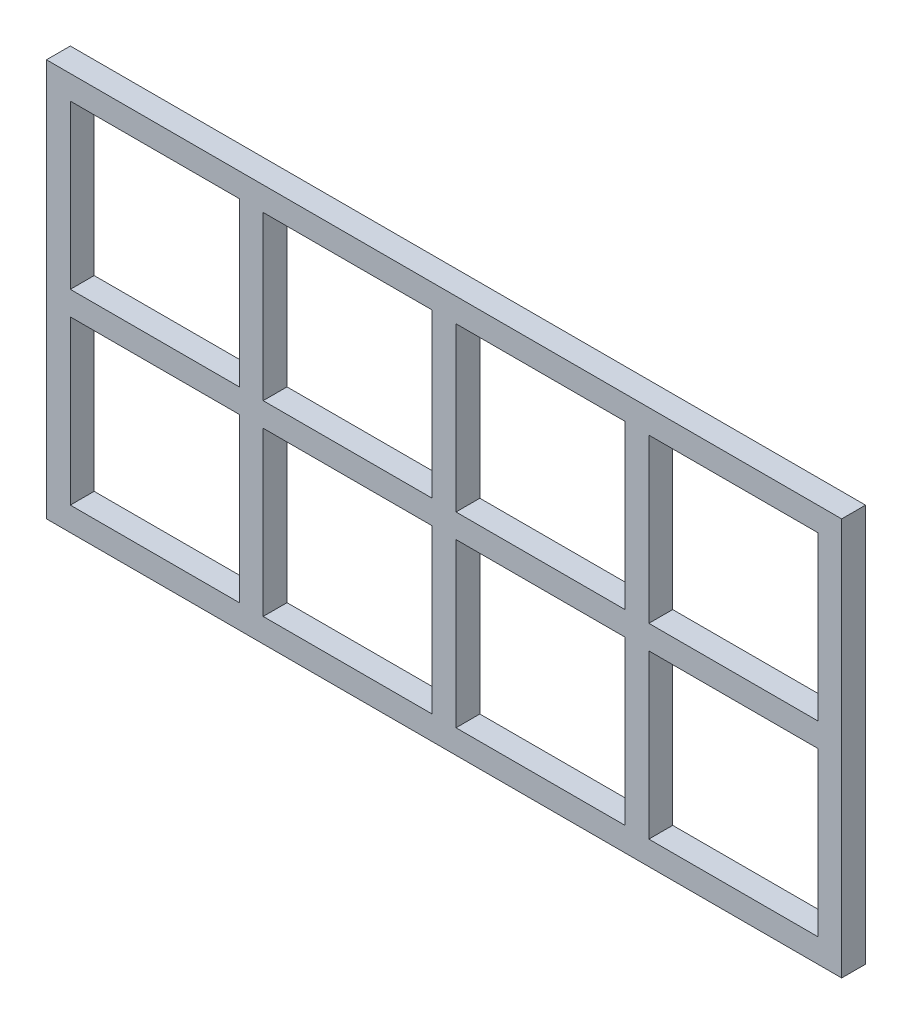
from build123d import *

# Parameters (mm, degrees)
SKETCH1_W           = 212.5
SKETCH1_H           = 205
BOSS_EXTRUDE1_DEPTH = 30


with BuildPart() as part:
    # Sketch1 → Boss-Extrude1 (new body)
    with BuildSketch(Plane.XY):
        Polygon((362.508649531, 238.132482623), (-637.491350469, 238.132482623), (-637.491350469, -261.867517377), (-244.284043551, -261.867517377), (-199.260806223, -261.867517377), (362.508649531, -261.867517377), (362.508649531, -252.360052791), (362.508649531, -202.360052791), (362.508649531, -10.504372942), (362.508649531, 19.495627058), align=None)
        with Locations((-501.241350469, -129.367517377)):
            Rectangle(SKETCH1_W, SKETCH1_H, mode=Mode.SUBTRACT)
        with Locations((-258.741350469, -129.367517377)):
            Rectangle(SKETCH1_W, SKETCH1_H, mode=Mode.SUBTRACT)
        with Locations((-16.241350469, -129.367517377)):
            Rectangle(SKETCH1_W, SKETCH1_H, mode=Mode.SUBTRACT)
        with Locations((226.258649531, -129.367517377)):
            Rectangle(SKETCH1_W, SKETCH1_H, mode=Mode.SUBTRACT)
        with Locations((-501.241350469, 105.632482623)):
            Rectangle(SKETCH1_W, SKETCH1_H, mode=Mode.SUBTRACT)
        with Locations((-258.741350469, 105.632482623)):
            Rectangle(SKETCH1_W, SKETCH1_H, mode=Mode.SUBTRACT)
        with Locations((-16.241350469, 105.632482623)):
            Rectangle(SKETCH1_W, SKETCH1_H, mode=Mode.SUBTRACT)
        with Locations((226.258649531, 105.632482623)):
            Rectangle(SKETCH1_W, SKETCH1_H, mode=Mode.SUBTRACT)
    extrude(amount=BOSS_EXTRUDE1_DEPTH)


solid = part.part
